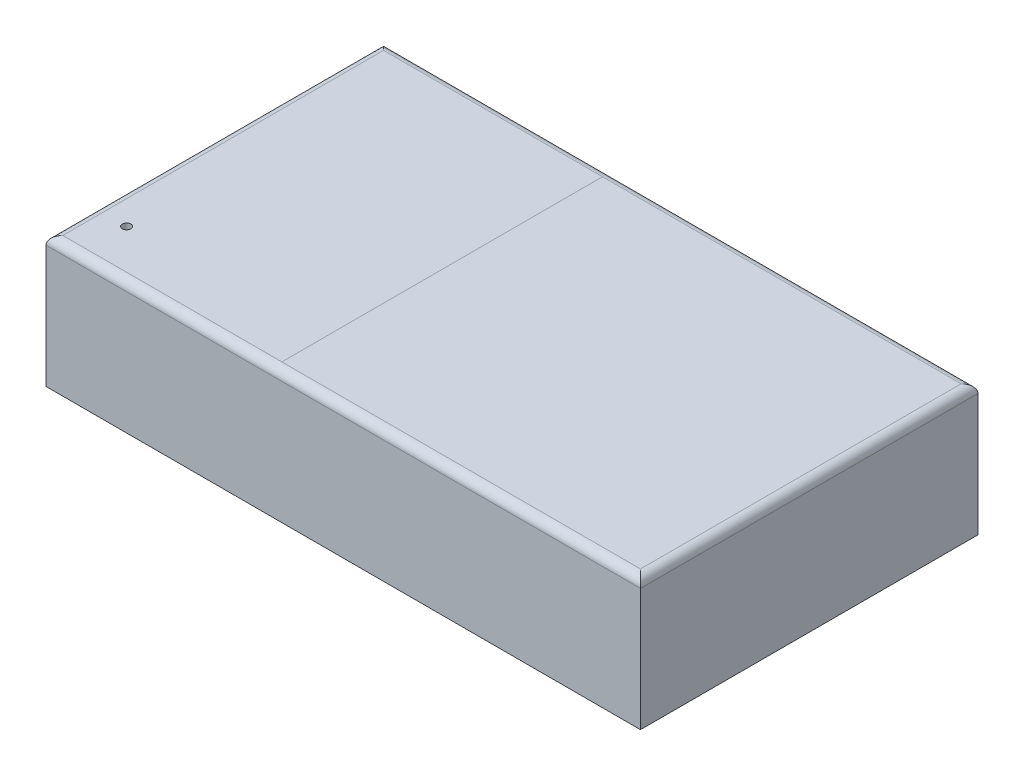
from build123d import *

# Parameters (mm, degrees)
SKETCH1_W           = 140.9
SKETCH1_H           = 80
BOSS_EXTRUDE1_DEPTH = 31
SHELL3_T            = -1.5
CUT_EXTRUDE2_DEPTH  = 1.5
SKETCH6_W           = 13.15
SKETCH6_H           = 7.1
CUT_EXTRUDE3_DEPTH  = 1.5
SKETCH9_W           = 16.15
SKETCH9_H           = 1.55
BOSS_EXTRUDE2_DEPTH = 1.5
SKETCH11_R          = 1
CUT_EXTRUDE4_DEPTH  = 1.5
FILLET7_R           = 2
SKETCH16_W          = 85
SKETCH16_H          = 76
CUT_EXTRUDE7_DEPTH  = 88.964779884
SKETCH16_3_W        = 85
SKETCH16_3_H        = 76
BOSS_EXTRUDE6_DEPTH = 1.5
SKETCH19_W          = 1.5
SKETCH19_H          = 77
BOSS_EXTRUDE7_DEPTH = 29.5


with BuildPart() as part:
    # Sketch1 → Boss-Extrude1 (new body)
    with BuildSketch(Plane(origin=(0, 0, 0), x_dir=(1, 0, 0), z_dir=(0, 1, 0))):
        Rectangle(SKETCH1_W, SKETCH1_H)
    extrude(amount=BOSS_EXTRUDE1_DEPTH)

    # Shell3
    shell3_openings = [part.faces().sort_by_distance(p)[0] for p in [
        (0, 0, 0),
    ]]
    offset(amount=SHELL3_T, openings=shell3_openings, kind=Kind.INTERSECTION)

    # Sketch4 → Cut-Extrude2 (cut)
    with BuildSketch(Plane.ZY.offset(70.45)):
        with BuildLine():
            Line((-34.3, 3.2), (-28.56, 3.2))
            ThreePointArc((-28.56, 3.2), (-26.96, 1.6), (-28.56, 0))
            Line((-28.56, 0), (-34.3, 0))
            ThreePointArc((-34.3, 0), (-35.9, 1.6), (-34.3, 3.2))
        make_face()
    extrude(amount=-CUT_EXTRUDE2_DEPTH, mode=Mode.SUBTRACT)

    # Sketch6 → Cut-Extrude3 (cut)
    with BuildSketch(Plane.ZY.offset(70.45)):
        with Locations((-17.575, 3.55)):
            Rectangle(SKETCH6_W, SKETCH6_H)
    extrude(amount=-CUT_EXTRUDE3_DEPTH, mode=Mode.SUBTRACT)

    # Sketch9 → Boss-Extrude2 (add)
    with BuildSketch(Plane.ZY.offset(70.45)):
        with Locations((-17.575, 0.775)):
            Rectangle(SKETCH9_W, SKETCH9_H)
    extrude(amount=BOSS_EXTRUDE2_DEPTH)

    # Sketch11 → Cut-Extrude4 (cut)
    with BuildSketch(Plane(origin=(0, 31, 0), x_dir=(1, 0, 0), z_dir=(0, 1, 0))):
        with Locations((-62.75, -28.6)):
            Circle(SKETCH11_R)
    extrude(amount=-CUT_EXTRUDE4_DEPTH, mode=Mode.SUBTRACT)

    # Fillet7
    fillet7_edges = [part.edges().sort_by_distance(p)[0] for p in [
        (70.45, 31, 0),
        (0, 31, 40),
        (0, 31, -40),
        (-70.45, 31, 0),
    ]]
    fillet(fillet7_edges, radius=FILLET7_R)

    # Sketch16 → Cut-Extrude7 (cut, through all)
    with BuildSketch(Plane(origin=(0, 31, 0), x_dir=(1, 0, 0), z_dir=(0, 1, 0))):
        with Locations((25.95, 0)):
            Rectangle(SKETCH16_W, SKETCH16_H)
    extrude(amount=-CUT_EXTRUDE7_DEPTH, mode=Mode.SUBTRACT)


with BuildPart() as body_2:
    # Sketch16<3> → Boss-Extrude6 (new body)
    with BuildSketch(Plane(origin=(0, 31, 0), x_dir=(1, 0, 0), z_dir=(0, 1, 0))):
        with Locations((25.95, 0)):
            Rectangle(SKETCH16_3_W, SKETCH16_3_H)
    extrude(amount=-BOSS_EXTRUDE6_DEPTH)


with BuildPart() as body_3:
    # Sketch19 → Boss-Extrude7 (new body)
    with BuildSketch(Plane(origin=(0, 29.5, 0), x_dir=(-1, 0, 0), z_dir=(0, -1, 0))):
        with Locations((17.3, 0)):
            Rectangle(SKETCH19_W, SKETCH19_H)
    extrude(amount=BOSS_EXTRUDE7_DEPTH)


solid = Compound([part.part, body_2.part, body_3.part])
